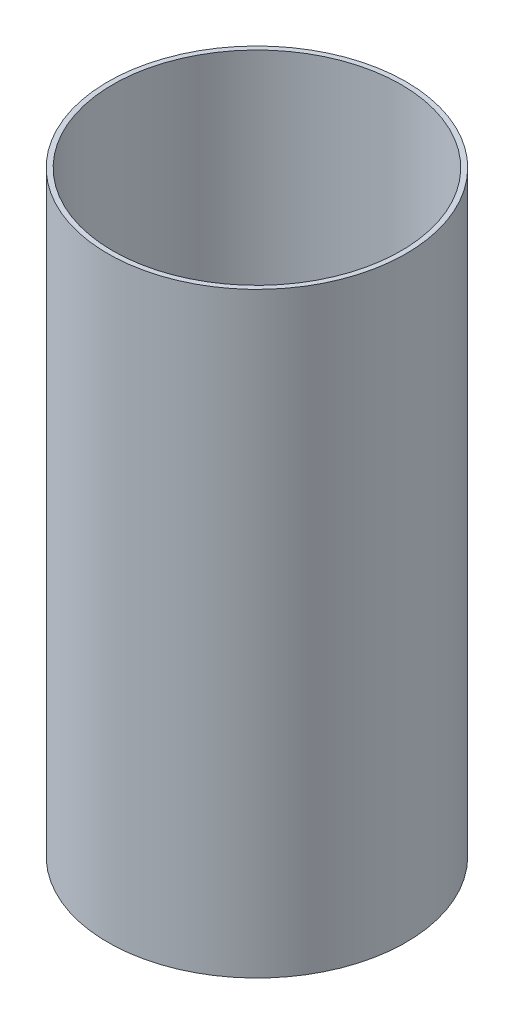
from build123d import *

# Parameters (mm, degrees)
SKETCH1_R           = 76.1746
SKETCH1_R_2         = 73.66
BOSS_EXTRUDE1_DEPTH = 304.8


with BuildPart() as part:
    # Sketch1 → Boss-Extrude1 (new body)
    with BuildSketch(Plane(origin=(0, 0, 0), x_dir=(1, 0, 0), z_dir=(0, 1, 0))):
        Circle(SKETCH1_R)
        Circle(SKETCH1_R_2, mode=Mode.SUBTRACT)
    extrude(amount=BOSS_EXTRUDE1_DEPTH)


solid = part.part
